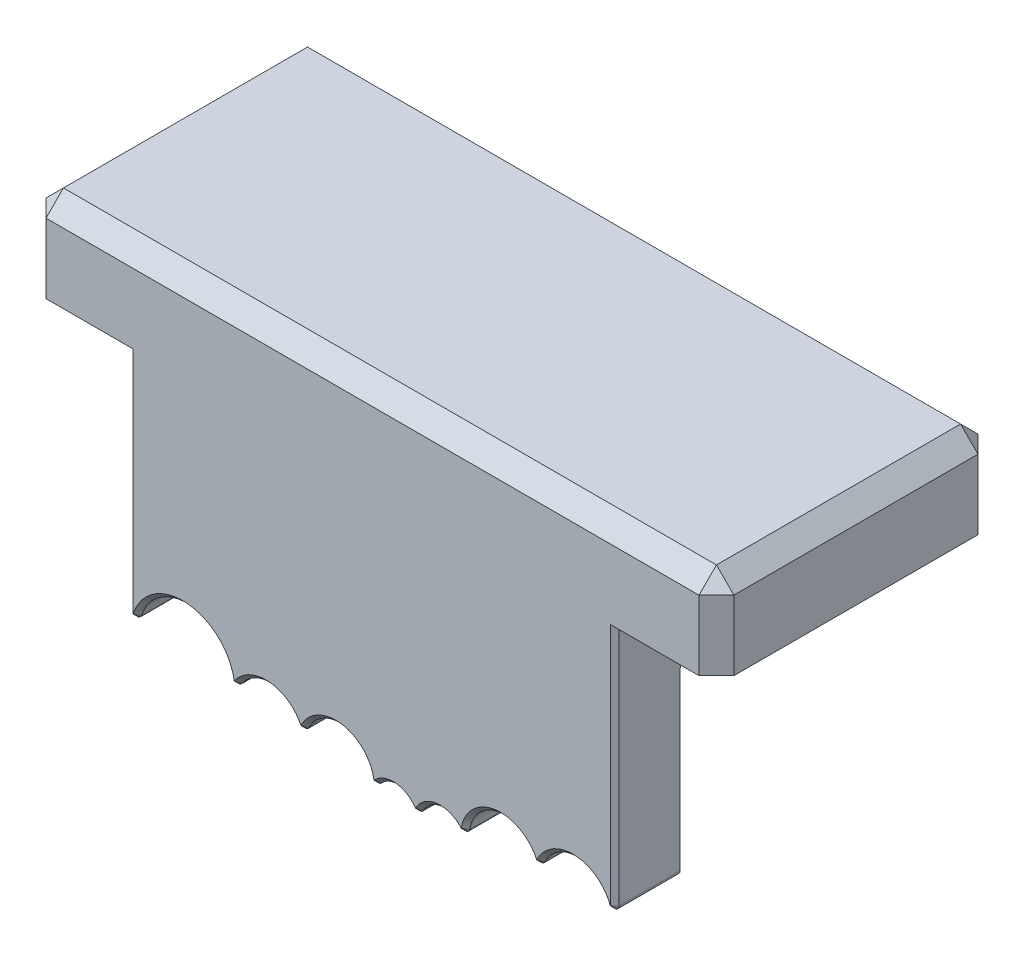
from build123d import *

# Parameters (mm, degrees)
SKETCH3_W           = 78.9
SKETCH3_H           = 32
BOSS_EXTRUDE1_DEPTH = 10
SKETCH3_4_R         = 2.375
CUT_EXTRUDE1_DEPTH  = 8
SKETCH4_W           = 55.74
SKETCH4_H           = 33.5
BOSS_EXTRUDE2_DEPTH = 8
CUT_EXTRUDE2_REACH  = 62.849
FILLET1_R           = 8
CHAMFER1_SIZE       = 2
CHAMFER2_SIZE       = 0.5


with BuildPart() as part:
    # Sketch3 → Boss-Extrude1 (new body)
    with BuildSketch(Plane(origin=(0, 0, 0), x_dir=(1, 0, 0), z_dir=(0, 1, 0))):
        with Locations((0, 16)):
            Rectangle(SKETCH3_W, SKETCH3_H)
    extrude(amount=BOSS_EXTRUDE1_DEPTH)

    # Sketch3<4> → Cut-Extrude1 (cut)
    with BuildSketch(Plane(origin=(0, 0, 0), x_dir=(1, 0, 0), z_dir=(0, 1, 0))):
        with Locations(Location((-34.45, 9.5, 0), (0, 0, 270))):
            Circle(SKETCH3_4_R)
        with Locations(Location((34.45, 9.5, 0), (0, 0, 270))):
            Circle(SKETCH3_4_R)
        with Locations(Location((-34.45, 25.5, 0), (0, 0, 270))):
            Circle(SKETCH3_4_R)
        with Locations(Location((34.45, 25.5, 0), (0, 0, 270))):
            Circle(SKETCH3_4_R)
    extrude(amount=CUT_EXTRUDE1_DEPTH, mode=Mode.SUBTRACT)

    # Sketch4 → Boss-Extrude2 (add)
    with BuildSketch(Plane.XY):
        with Locations((-0.082754798, -16.75)):
            Rectangle(SKETCH4_W, SKETCH4_H)
    extrude(amount=-BOSS_EXTRUDE2_DEPTH)

    # Sketch6 → Cut-Extrude2 (cut, up to next)
    with BuildSketch(Plane.XY, mode=Mode.PRIVATE) as cut_extrude2_sk1:
        with BuildLine():
            Line((-27.952754798, -33.5), (27.787245202, -33.5))
            Line((27.787245202, -33.5), (27.787245202, -27.949055839))
            ThreePointArc((27.787245202, -27.949055839), (27.374711042, -28.441346126), (26.817846295, -28.121290173))
            ThreePointArc((26.817846295, -28.121290173), (23.160845315, -25.453489346), (19.295797115, -27.809804228))
            ThreePointArc((19.295797115, -27.809804228), (18.842245202, -28.099350759), (18.388693289, -27.809804228))
            ThreePointArc((18.388693289, -27.809804228), (14.135992665, -25.488143783), (10.669672877, -28.873435048))
            ThreePointArc((10.669672877, -28.873435048), (10.313792265, -29.274157145), (9.799721264, -29.122630861))
            ThreePointArc((9.799721264, -29.122630861), (7.44477434, -28.219326103), (5.371236745, -29.655354078))
            ThreePointArc((5.371236745, -29.655354078), (4.951993147, -29.92426536), (4.508475892, -29.697613829))
            ThreePointArc((4.508475892, -29.697613829), (2.60438519, -28.558927341), (0.536516234, -29.362722278))
            ThreePointArc((0.536516234, -29.362722278), (0.021886532, -29.501511273), (-0.325508515, -29.097255418))
            ThreePointArc((-0.325508515, -29.097255418), (-3.632594875, -25.792369955), (-7.755777397, -27.996560058))
            ThreePointArc((-7.755777397, -27.996560058), (-8.207754798, -28.282746053), (-8.659732199, -27.996560058))
            ThreePointArc((-8.659732199, -27.996560058), (-11.896894258, -25.762329464), (-15.446236111, -27.45737429))
            ThreePointArc((-15.446236111, -27.45737429), (-15.968076529, -27.66278259), (-16.352419433, -27.254382635))
            ThreePointArc((-16.352419433, -27.254382635), (-21.353910692, -22.664914384), (-26.97618576, -26.468617408))
            ThreePointArc((-26.97618576, -26.468617408), (-27.529290676, -26.81145713), (-27.952754798, -26.317349591))
            Line((-27.952754798, -26.317349591), (-27.952754798, -33.5))
        make_face()
    cut_extrude2_tool1 = extrude(cut_extrude2_sk1.sketch, amount=-CUT_EXTRUDE2_REACH, mode=Mode.PRIVATE) & part.part
    add(cut_extrude2_tool1.solids().sort_by_distance((-1.952714, -29.732571, 0))[0], mode=Mode.SUBTRACT)

    # Fillet1
    fillet1_edges = [part.edges().sort_by_distance(p)[0] for p in [
        (-0.082754798, 0, -8),
    ]]
    fillet(fillet1_edges, radius=FILLET1_R)

    # Chamfer1
    chamfer1_edges = [part.edges().sort_by_distance(p)[0] for p in [
        (39.45, 10, -16),
        (0, 10, 0),
        (-39.45, 10, -16),
        (0, 10, -32),
        (-39.45, 5, 0),
        (39.45, 5, 0),
        (39.45, 5, -32),
        (-39.45, 5, -32),
    ]]
    chamfer(chamfer1_edges, length=CHAMFER1_SIZE)

    # Chamfer2
    # the kernel refuses this chamfer: 0.5 mm, written as the material it takes off along each edge
    with BuildSketch(Plane(origin=(-27.952754798, -26.317349591, 0), x_dir=(1, 0, 0), z_dir=(0, 1, 0))) as chamfer2_piece_1:
        Polygon((CHAMFER2_SIZE, 0), (0, CHAMFER2_SIZE), (0, 0), align=None)
    extrude(amount=26.317349591, mode=Mode.SUBTRACT)
    with BuildSketch(Plane(origin=(27.787245202, -8, -8), x_dir=(0, 0, 1), z_dir=(0, -1, 0))) as chamfer2_piece_2:
        Polygon((CHAMFER2_SIZE, 0), (0, CHAMFER2_SIZE), (0, 0), align=None)
    extrude(amount=19.949055839, mode=Mode.SUBTRACT)
    with BuildSketch(Plane(origin=(27.787245202, 0, 0), x_dir=(-1, 0, 0), z_dir=(0, -1, 0))) as chamfer2_piece_3:
        Polygon((CHAMFER2_SIZE, 0), (0, CHAMFER2_SIZE), (0, 0), align=None)
    extrude(amount=27.949055839, mode=Mode.SUBTRACT)
    with BuildSketch(Plane(origin=(-15.858781501, -27.1748742, -8), x_dir=(-0.987275865677397, -0.15901687033439718, 0), z_dir=(-0.15901687033439718, 0.987275865677397, 0))) as chamfer2_piece_4:
        Polygon((0.5, CHAMFER2_SIZE), (0.5 - CHAMFER2_SIZE, 0), (0.5, 0), align=None)
    revolve(axis=Axis((-15.858781501, -27.1748742, -8), (0, 0, 1)), revolution_arc=136.447859655, mode=Mode.SUBTRACT)
    with BuildSketch(Plane(origin=(-12.207754798, -29.675, -8), x_dir=(0.9039548022598873, 0.4276280106252253, 0), z_dir=(0.4276280106252253, -0.9039548022598873, 0))) as chamfer2_piece_5:
        Polygon((3.925, CHAMFER2_SIZE), (3.925 + CHAMFER2_SIZE, 0), (3.925, 0), align=None)
    revolve(axis=Axis((-12.207754798, -29.675, -8), (0, 0, 1)), revolution_arc=120.280574477, mode=Mode.SUBTRACT)
    with BuildSketch(Plane(origin=(-8.207754798, -27.782746053, -8), x_dir=(-0.9039548022598843, -0.427628010625232, 0), z_dir=(-0.427628010625232, 0.9039548022598843, 0))) as chamfer2_piece_6:
        Polygon((0.5, CHAMFER2_SIZE), (0.5 - CHAMFER2_SIZE, 0), (0.5, 0), align=None)
    revolve(axis=Axis((-8.207754798, -27.782746053, -8), (0, 0, 1)), revolution_arc=129.365756689, mode=Mode.SUBTRACT)
    with BuildSketch(Plane(origin=(-4.207754798, -29.675, -8), x_dir=(0.9891073331389847, 0.1471960717230098, 0), z_dir=(0.1471960717230098, -0.9891073331389847, 0))) as chamfer2_piece_7:
        Polygon((3.925, CHAMFER2_SIZE), (3.925 + CHAMFER2_SIZE, 0), (3.925, 0), align=None)
    revolve(axis=Axis((-4.207754798, -29.675, -8), (0, 0, 1)), revolution_arc=146.218408748, mode=Mode.SUBTRACT)
    with BuildSketch(Plane(origin=(0.169045151, -29.023657383, -8), x_dir=(-0.989107333138985, -0.14719607172300886, 0), z_dir=(-0.14719607172300886, 0.989107333138985, 0))) as chamfer2_piece_8:
        Polygon((0.5, CHAMFER2_SIZE), (0.5 - CHAMFER2_SIZE, 0), (0.5, 0), align=None)
    revolve(axis=Axis((0.169045151, -29.023657383, -8), (0, 0, 1)), revolution_arc=128.837859802, mode=Mode.SUBTRACT)
    with BuildSketch(Plane(origin=(2.392245202, -31.075, -8), x_dir=(0.8381111645487582, 0.5454994737474312, 0), z_dir=(0.5454994737474312, -0.8381111645487582, 0))) as chamfer2_piece_9:
        Polygon((2.525, CHAMFER2_SIZE), (2.525 + CHAMFER2_SIZE, 0), (2.525, 0), align=None)
    revolve(axis=Axis((2.392245202, -31.075, -8), (0, 0, 1)), revolution_arc=104.243526868, mode=Mode.SUBTRACT)
    with BuildSketch(Plane(origin=(4.927531475, -29.424864092, -8), x_dir=(-0.8381111645487566, -0.5454994737474338, 0), z_dir=(-0.5454994737474338, 0.8381111645487566, 0))) as chamfer2_piece_10:
        Polygon((0.5, CHAMFER2_SIZE), (0.5 - CHAMFER2_SIZE, 0), (0.5, 0), align=None)
    revolve(axis=Axis((4.927531475, -29.424864092, -8), (0, 0, 1)), revolution_arc=119.490836117, mode=Mode.SUBTRACT)
    with BuildSketch(Plane(origin=(7.767245202, -30.9, -8), x_dir=(0.7527689119185456, 0.6582848663374914, 0), z_dir=(0.6582848663374914, -0.7527689119185456, 0))) as chamfer2_piece_11:
        Polygon((2.7, CHAMFER2_SIZE), (2.7 + CHAMFER2_SIZE, 0), (2.7, 0), align=None)
    revolve(axis=Axis((7.767245202, -30.9, -8), (0, 0, 1)), revolution_arc=111.380440885, mode=Mode.SUBTRACT)
    with BuildSketch(Plane(origin=(10.17610572, -28.793488428, -8), x_dir=(-0.7527689119185441, -0.6582848663374932, 0), z_dir=(-0.6582848663374932, 0.7527689119185441, 0))) as chamfer2_piece_12:
        Polygon((0.5, CHAMFER2_SIZE), (0.5 - CHAMFER2_SIZE, 0), (0.5, 0), align=None)
    revolve(axis=Axis((10.17610572, -28.793488428, -8), (0, 0, 1)), revolution_arc=129.630102702, mode=Mode.SUBTRACT)
    with BuildSketch(Plane(origin=(14.692245202, -29.525, -8), x_dir=(0.9071038251366096, 0.42090693795960527, 0), z_dir=(0.42090693795960527, -0.9071038251366096, 0))) as chamfer2_piece_13:
        Polygon((4.075, CHAMFER2_SIZE), (4.075 + CHAMFER2_SIZE, 0), (4.075, 0), align=None)
    revolve(axis=Axis((14.692245202, -29.525, -8), (0, 0, 1)), revolution_arc=145.907440943, mode=Mode.SUBTRACT)
    with BuildSketch(Plane(origin=(18.842245202, -27.599350759, -8), x_dir=(-0.9071038251366129, -0.4209069379595987, 0), z_dir=(-0.4209069379595987, 0.9071038251366129, 0))) as chamfer2_piece_14:
        Polygon((0.5, CHAMFER2_SIZE), (0.5 - CHAMFER2_SIZE, 0), (0.5, 0), align=None)
    revolve(axis=Axis((18.842245202, -27.599350759, -8), (0, 0, 1)), revolution_arc=130.21628096, mode=Mode.SUBTRACT)
    with BuildSketch(Plane(origin=(22.992245202, -29.525, -8), x_dir=(0.9387978142076504, 0.3444686691688196, 0), z_dir=(0.3444686691688196, -0.9387978142076504, 0))) as chamfer2_piece_15:
        Polygon((4.075, CHAMFER2_SIZE), (4.075 + CHAMFER2_SIZE, 0), (4.075, 0), align=None)
    revolve(axis=Axis((22.992245202, -29.525, -8), (0, 0, 1)), revolution_arc=134.95877574, mode=Mode.SUBTRACT)
    with BuildSketch(Plane(origin=(27.287245202, -27.949055839, -8), x_dir=(-0.9387978142076511, -0.3444686691688182, 0), z_dir=(-0.3444686691688182, 0.9387978142076511, 0))) as chamfer2_piece_16:
        Polygon((0.5, CHAMFER2_SIZE), (0.5 - CHAMFER2_SIZE, 0), (0.5, 0), align=None)
    revolve(axis=Axis((27.287245202, -27.949055839, -8), (0, 0, 1)), revolution_arc=159.85063526, mode=Mode.SUBTRACT)
    with BuildSketch(Plane(origin=(-27.452754798, -26.317349591, -8), x_dir=(-1, 0, 0), z_dir=(0, 1, 0))) as chamfer2_piece_17:
        Polygon((0.5, CHAMFER2_SIZE), (0.5 - CHAMFER2_SIZE, 0), (0.5, 0), align=None)
    revolve(axis=Axis((-27.452754798, -26.317349591, -8), (0, 0, 1)), revolution_arc=162.390037032, mode=Mode.SUBTRACT)
    with BuildSketch(Plane(origin=(-21.757754798, -28.125, -8), x_dir=(0.9872758656773971, 0.1590168703343955, 0), z_dir=(0.1590168703343955, -0.9872758656773971, 0))) as chamfer2_piece_18:
        Polygon((5.475, CHAMFER2_SIZE), (5.475 + CHAMFER2_SIZE, 0), (5.475, 0), align=None)
    revolve(axis=Axis((-21.757754798, -28.125, -8), (0, 0, 1)), revolution_arc=153.240200555, mode=Mode.SUBTRACT)
    with BuildSketch(Plane(origin=(-15.858781501, -27.1748742, 0), x_dir=(0.8250907802435141, -0.5650001808470059, 0), z_dir=(0.5650001808470059, 0.8250907802435141, 0))) as chamfer2_piece_19:
        Polygon((0.5 - CHAMFER2_SIZE, 0), (0.5, CHAMFER2_SIZE), (0.5, 0), align=None)
    revolve(axis=Axis((-15.858781501, -27.1748742, 0), (0, 0, -1)), revolution_arc=136.447859655, mode=Mode.SUBTRACT)
    with BuildSketch(Plane(origin=(-21.757754798, -28.125, 0), x_dir=(0.9872758656773971, 0.1590168703343955, 0), z_dir=(0.1590168703343955, -0.9872758656773971, 0))) as chamfer2_piece_20:
        Polygon((5.475 + CHAMFER2_SIZE, 0), (5.475, -CHAMFER2_SIZE), (5.475, 0), align=None)
    revolve(axis=Axis((-21.757754798, -28.125, 0), (0, 0, 1)), revolution_arc=153.240200555, mode=Mode.SUBTRACT)
    with BuildSketch(Plane(origin=(-27.452754798, -26.317349591, 0), x_dir=(0.9531380753138083, -0.3025356332518353, 0), z_dir=(0.3025356332518353, 0.9531380753138083, 0))) as chamfer2_piece_21:
        Polygon((0.5 - CHAMFER2_SIZE, 0), (0.5, CHAMFER2_SIZE), (0.5, 0), align=None)
    revolve(axis=Axis((-27.452754798, -26.317349591, 0), (0, 0, -1)), revolution_arc=162.390037032, mode=Mode.SUBTRACT)
    with BuildSketch(Plane(origin=(27.287245202, -27.949055839, 0), x_dir=(1, 0, 0), z_dir=(0, 1, 0))) as chamfer2_piece_22:
        Polygon((0.5 - CHAMFER2_SIZE, 0), (0.5, CHAMFER2_SIZE), (0.5, 0), align=None)
    revolve(axis=Axis((27.287245202, -27.949055839, 0), (0, 0, -1)), revolution_arc=159.85063526, mode=Mode.SUBTRACT)
    with BuildSketch(Plane(origin=(22.992245202, -29.525, 0), x_dir=(0.9387978142076504, 0.3444686691688196, 0), z_dir=(0.3444686691688196, -0.9387978142076504, 0))) as chamfer2_piece_23:
        Polygon((4.075 + CHAMFER2_SIZE, 0), (4.075, -CHAMFER2_SIZE), (4.075, 0), align=None)
    revolve(axis=Axis((22.992245202, -29.525, 0), (0, 0, 1)), revolution_arc=134.95877574, mode=Mode.SUBTRACT)
    with BuildSketch(Plane(origin=(18.842245202, -27.599350759, 0), x_dir=(0.9071038251366116, -0.4209069379596014, 0), z_dir=(0.4209069379596014, 0.9071038251366116, 0))) as chamfer2_piece_24:
        Polygon((0.5 - CHAMFER2_SIZE, 0), (0.5, CHAMFER2_SIZE), (0.5, 0), align=None)
    revolve(axis=Axis((18.842245202, -27.599350759, 0), (0, 0, -1)), revolution_arc=130.21628096, mode=Mode.SUBTRACT)
    with BuildSketch(Plane(origin=(14.692245202, -29.525, 0), x_dir=(0.9071038251366096, 0.42090693795960527, 0), z_dir=(0.42090693795960527, -0.9071038251366096, 0))) as chamfer2_piece_25:
        Polygon((4.075 + CHAMFER2_SIZE, 0), (4.075, -CHAMFER2_SIZE), (4.075, 0), align=None)
    revolve(axis=Axis((14.692245202, -29.525, 0), (0, 0, 1)), revolution_arc=145.907440943, mode=Mode.SUBTRACT)
    with BuildSketch(Plane(origin=(10.17610572, -28.793488428, 0), x_dir=(0.9871343129750032, -0.15989323984261683, 0), z_dir=(0.15989323984261683, 0.9871343129750032, 0))) as chamfer2_piece_26:
        Polygon((0.5 - CHAMFER2_SIZE, 0), (0.5, CHAMFER2_SIZE), (0.5, 0), align=None)
    revolve(axis=Axis((10.17610572, -28.793488428, 0), (0, 0, -1)), revolution_arc=129.630102702, mode=Mode.SUBTRACT)
    with BuildSketch(Plane(origin=(7.767245202, -30.9, 0), x_dir=(0.7527689119185456, 0.6582848663374914, 0), z_dir=(0.6582848663374914, -0.7527689119185456, 0))) as chamfer2_piece_27:
        Polygon((2.7 + CHAMFER2_SIZE, 0), (2.7, -CHAMFER2_SIZE), (2.7, 0), align=None)
    revolve(axis=Axis((7.767245202, -30.9, 0), (0, 0, 1)), revolution_arc=111.380440885, mode=Mode.SUBTRACT)
    with BuildSketch(Plane(origin=(4.927531475, -29.424864092, 0), x_dir=(0.8874105397625023, -0.4609799712768705, 0), z_dir=(0.4609799712768705, 0.8874105397625023, 0))) as chamfer2_piece_28:
        Polygon((0.5 - CHAMFER2_SIZE, 0), (0.5, CHAMFER2_SIZE), (0.5, 0), align=None)
    revolve(axis=Axis((4.927531475, -29.424864092, 0), (0, 0, -1)), revolution_arc=119.490836117, mode=Mode.SUBTRACT)
    with BuildSketch(Plane(origin=(2.392245202, -31.075, 0), x_dir=(0.8381111645487582, 0.5454994737474312, 0), z_dir=(0.5454994737474312, -0.8381111645487582, 0))) as chamfer2_piece_29:
        Polygon((2.525 + CHAMFER2_SIZE, 0), (2.525, -CHAMFER2_SIZE), (2.525, 0), align=None)
    revolve(axis=Axis((2.392245202, -31.075, 0), (0, 0, 1)), revolution_arc=104.243526868, mode=Mode.SUBTRACT)
    with BuildSketch(Plane(origin=(0.169045151, -29.023657383, 0), x_dir=(0.734942165573552, -0.6781297908675433, 0), z_dir=(0.6781297908675433, 0.734942165573552, 0))) as chamfer2_piece_30:
        Polygon((0.5 - CHAMFER2_SIZE, 0), (0.5, CHAMFER2_SIZE), (0.5, 0), align=None)
    revolve(axis=Axis((0.169045151, -29.023657383, 0), (0, 0, -1)), revolution_arc=128.837859802, mode=Mode.SUBTRACT)
    with BuildSketch(Plane(origin=(-4.207754798, -29.675, 0), x_dir=(0.9891073331389847, 0.1471960717230098, 0), z_dir=(0.1471960717230098, -0.9891073331389847, 0))) as chamfer2_piece_31:
        Polygon((3.925 + CHAMFER2_SIZE, 0), (3.925, -CHAMFER2_SIZE), (3.925, 0), align=None)
    revolve(axis=Axis((-4.207754798, -29.675, 0), (0, 0, 1)), revolution_arc=146.218408748, mode=Mode.SUBTRACT)
    with BuildSketch(Plane(origin=(-8.207754798, -27.782746053, 0), x_dir=(0.9039548022598843, -0.427628010625232, 0), z_dir=(0.427628010625232, 0.9039548022598843, 0))) as chamfer2_piece_32:
        Polygon((0.5 - CHAMFER2_SIZE, 0), (0.5, CHAMFER2_SIZE), (0.5, 0), align=None)
    revolve(axis=Axis((-8.207754798, -27.782746053, 0), (0, 0, -1)), revolution_arc=129.365756689, mode=Mode.SUBTRACT)
    with BuildSketch(Plane(origin=(-12.207754798, -29.675, 0), x_dir=(0.9039548022598873, 0.4276280106252253, 0), z_dir=(0.4276280106252253, -0.9039548022598873, 0))) as chamfer2_piece_33:
        Polygon((3.925 + CHAMFER2_SIZE, 0), (3.925, -CHAMFER2_SIZE), (3.925, 0), align=None)
    revolve(axis=Axis((-12.207754798, -29.675, 0), (0, 0, 1)), revolution_arc=120.280574477, mode=Mode.SUBTRACT)
    with BuildSketch(Plane(origin=(-27.952754798, -26.317349591, -8), x_dir=(0, 0, 1), z_dir=(0, 1, 0))) as chamfer2_piece_34:
        Polygon((CHAMFER2_SIZE, 0), (0, CHAMFER2_SIZE), (0, 0), align=None)
    extrude(amount=18.317349591, mode=Mode.SUBTRACT)
    with BuildSketch(Plane(origin=(-27.952754798, -8, -16), x_dir=(0, 0.8858914010009324, -0.4638926876257108), z_dir=(0, -0.4638926876257108, -0.8858914010009324))) as chamfer2_piece_35_section:
        Polygon((8 + CHAMFER2_SIZE, 0), (8, CHAMFER2_SIZE), (8, 0), align=None)
    chamfer2_piece_35 = revolve(axis=Axis((-27.952754798, -8, -16), (1, 0, 0)), revolution_arc=117.638582209, mode=Mode.PRIVATE)
    chamfer2_piece_35 = split(chamfer2_piece_35, bisect_by=Plane(origin=(-27.952754798, 0, -16), z_dir=(0, -1, 0)), keep=Keep.TOP, mode=Mode.PRIVATE)
    add(chamfer2_piece_35, mode=Mode.SUBTRACT)
    with BuildSketch(Plane(origin=(27.787245202, -8, -16), x_dir=(0, 0.8858914010009324, -0.4638926876257108), z_dir=(0, -0.4638926876257108, -0.8858914010009324))) as chamfer2_piece_36_section:
        Polygon((8, -CHAMFER2_SIZE), (8 + CHAMFER2_SIZE, 0), (8, 0), align=None)
    chamfer2_piece_36 = revolve(axis=Axis((27.787245202, -8, -16), (1, 0, 0)), revolution_arc=117.638582209, mode=Mode.PRIVATE)
    chamfer2_piece_36 = split(chamfer2_piece_36, bisect_by=Plane(origin=(27.787245202, 0, -16), z_dir=(0, -1, 0)), keep=Keep.TOP, mode=Mode.PRIVATE)
    add(chamfer2_piece_36, mode=Mode.SUBTRACT)


solid = part.part
